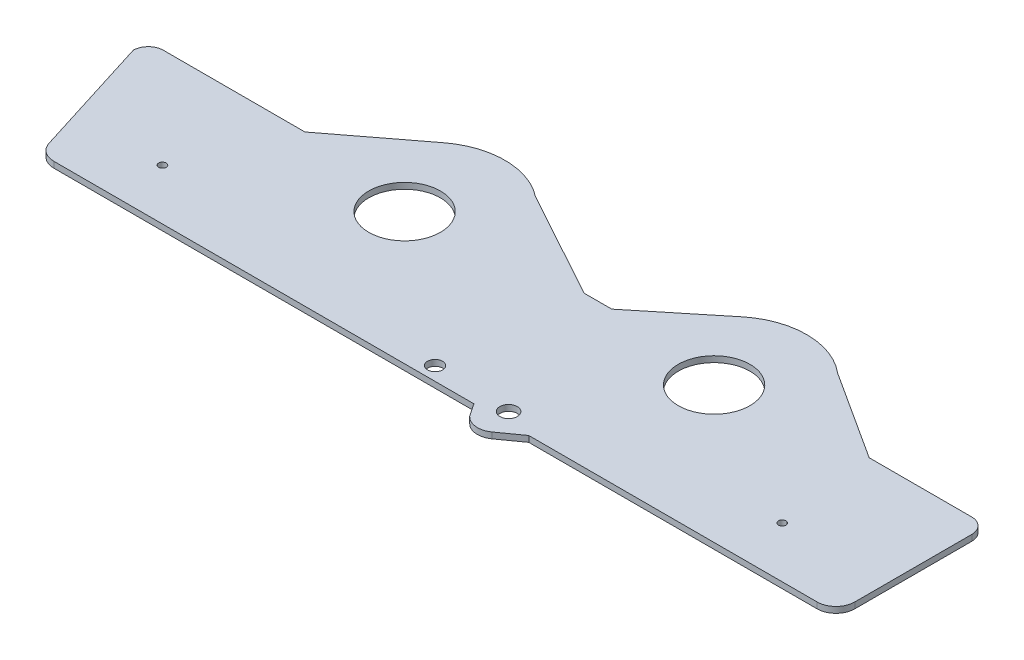
from build123d import *

# Parameters (mm, degrees)
SKETCH1_R                = 4.6
BOSS_EXTRUDE1_DEPTH      = 3.175
SKETCH2_W                = 597.466303312
SKETCH2_H                = 60.972543052
CUT_EXTRUDE1_DEPTH       = 70
FILLET1_R                = 10
FILLET2_R                = 10
SKETCH3_R                = 3.990837639
CUT_EXTRUDE2_DEPTH       = 10
SKETCH4_R                = 2
CUT_EXTRUDE3_DEPTH       = 470.13785887
SKETCH5_R                = 2
CUT_EXTRUDE4_DEPTH       = 10
SKETCH6_R                = 40
BOSS_EXTRUDE2_DEPTH      = 3.175
BOSS_EXTRUDE3_DEPTH      = 3.175
BOSS_EXTRUDE4_DEPTH      = 3.175
BOSS_EXTRUDE6_DEPTH      = 3.175
SKETCH13_R               = 19
CUT_EXTRUDE5_DEPTH       = 10
SKETCH14_R               = 19
CUT_EXTRUDE6_DEPTH       = 10
BOSS_EXTRUDE7_DEPTH      = 10
BOSS_EXTRUDE7_DEPTH_BACK = 3.175
SKETCH16_W               = 39.380598922
SKETCH16_H               = 33.904845405
CUT_EXTRUDE7_DEPTH       = 10


with BuildPart() as part:
    # Sketch1 → Boss-Extrude1 (new body)
    with BuildSketch(Plane(origin=(0, 0, 0), x_dir=(1, 0, 0), z_dir=(0, 1, 0))):
        with BuildLine():
            ThreePointArc((8, 150), (2.343145751, 147.656854249), (0, 142))
            Line((0, 142), (42, 8))
            ThreePointArc((42, 8), (44.343145751, 2.343145751), (50, 0))
            Line((50, 0), (436.5, 0))
            ThreePointArc((436.5, 0), (442.156854249, 2.343145751), (444.5, 8))
            Line((444.5, 8), (444.5, 142))
            ThreePointArc((444.5, 142), (442.156854249, 147.656854249), (436.5, 150))
            Line((436.5, 150), (8, 150))
        make_face()
        with Locations((265.338137381, 75.633853175)):
            Circle(SKETCH1_R, mode=Mode.SUBTRACT)
    extrude(amount=BOSS_EXTRUDE1_DEPTH)

    # Sketch2 → Cut-Extrude1 (cut)
    with BuildSketch(Plane.XY):
        with Locations((220.1785332, 7.544358636)):
            Rectangle(SKETCH2_W, SKETCH2_H)
    extrude(amount=-CUT_EXTRUDE1_DEPTH, mode=Mode.SUBTRACT)

    # Fillet1
    fillet1_edges = [part.edges().sort_by_distance(p)[0] for p in [
        (22.567164179, 1.5875, -70),
    ]]
    fillet(fillet1_edges, radius=FILLET1_R)

    # Fillet2
    fillet2_edges = [part.edges().sort_by_distance(p)[0] for p in [
        (444.5, 1.5875, -70),
    ]]
    fillet(fillet2_edges, radius=FILLET2_R)

    # Sketch3 → Cut-Extrude2 (cut)
    with BuildSketch(Plane(origin=(0, 3.175, 0), x_dir=(1, 0, 0), z_dir=(0, 1, 0))):
        with Locations((224.75, 77.255)):
            Circle(SKETCH3_R)
    extrude(amount=-CUT_EXTRUDE2_DEPTH, mode=Mode.SUBTRACT)

    # Sketch4 → Cut-Extrude3 (cut, through all)
    with BuildSketch(Plane(origin=(0, 3.175, 0), x_dir=(1, 0, 0), z_dir=(0, 1, 0))):
        with Locations((60.5, 97)):
            Circle(SKETCH4_R)
    extrude(amount=-CUT_EXTRUDE3_DEPTH, mode=Mode.SUBTRACT)

    # Sketch5 → Cut-Extrude4 (cut)
    with BuildSketch(Plane(origin=(0, 3.175, 0), x_dir=(1, 0, 0), z_dir=(0, 1, 0))):
        with Locations((389, 97)):
            Circle(SKETCH5_R)
    extrude(amount=-CUT_EXTRUDE4_DEPTH, mode=Mode.SUBTRACT)

    # Sketch6 → Boss-Extrude2 (add)
    with BuildSketch(Plane(origin=(0, 0, 0), x_dir=(1, 0, 0), z_dir=(0, 1, 0))):
        with Locations((149, 150.04039861)):
            Circle(SKETCH6_R)
    extrude(amount=BOSS_EXTRUDE2_DEPTH)

    # Sketch7 → Boss-Extrude3 (add)
    with BuildSketch(Plane(origin=(0, 0, 0), x_dir=(1, 0, 0), z_dir=(0, 1, 0))):
        Polygon((124.164543783, 181.396420591), (82.702881078, 149.750534228), (231.468946681, 149.750534228), (173.835456217, 181.396420591), align=None)
    extrude(amount=BOSS_EXTRUDE3_DEPTH)

    # Sketch9 → Boss-Extrude4 (add)
    with BuildSketch(Plane(origin=(0, 0, 0), x_dir=(1, 0, 0), z_dir=(0, 1, 0))):
        with BuildLine():
            Line((245.673378314, 150), (269, 150))
            ThreePointArc((269, 150), (345.129166999, 132.833658165), (283.734164599, 181.010281545))
            Line((283.734164599, 181.010281545), (245.673378314, 150))
        make_face()
    extrude(amount=BOSS_EXTRUDE4_DEPTH)

    # Sketch12 → Boss-Extrude6 (add)
    with BuildSketch(Plane(origin=(0, 0, 0), x_dir=(1, 0, 0), z_dir=(0, 1, 0))):
        Polygon((326.166341835, 186.129166999), (382.106475607, 150), (340.398839744, 150), align=None)
    extrude(amount=BOSS_EXTRUDE6_DEPTH)

    # Sketch13 → Cut-Extrude5 (cut)
    with BuildSketch(Plane(origin=(0, 3.175, 0), x_dir=(1, 0, 0), z_dir=(0, 1, 0))):
        with Locations((146, 139.84039861)):
            Circle(SKETCH13_R)
    extrude(amount=-CUT_EXTRUDE5_DEPTH, mode=Mode.SUBTRACT)

    # Sketch14 → Cut-Extrude6 (cut)
    with BuildSketch(Plane(origin=(0, 3.175, 0), x_dir=(1, 0, 0), z_dir=(0, 1, 0))):
        with Locations((307.606475607, 142.298064477)):
            Circle(SKETCH14_R)
    extrude(amount=-CUT_EXTRUDE6_DEPTH, mode=Mode.SUBTRACT)

    # Sketch15 → Boss-Extrude7 (add, two sides: drawn at the far end of the back side and taken through both)
    with BuildSketch(Plane(origin=(0, 3.175, 0), x_dir=(1, 0, 0), z_dir=(0, 1, 0)).offset(-BOSS_EXTRUDE7_DEPTH_BACK)):
        with BuildLine():
            Line((270.323640372, 61.870718801), (281.671389991, 70))
            Line((281.671389991, 70), (252.589726142, 70))
            Line((252.589726142, 70), (257.164027826, 63.204154779))
            ThreePointArc((257.164027826, 63.204154779), (263.491883069, 60.050944756), (270.323640372, 61.870718801))
        make_face()
    extrude(amount=BOSS_EXTRUDE7_DEPTH + BOSS_EXTRUDE7_DEPTH_BACK)

    # Sketch16 → Cut-Extrude7 (cut)
    with BuildSketch(Plane(origin=(0, 13.175, 0), x_dir=(1, 0, 0), z_dir=(0, 1, 0))):
        with Locations((267.135263248, 68.050551455)):
            Rectangle(SKETCH16_W, SKETCH16_H)
    extrude(amount=-CUT_EXTRUDE7_DEPTH, mode=Mode.SUBTRACT)


solid = part.part
